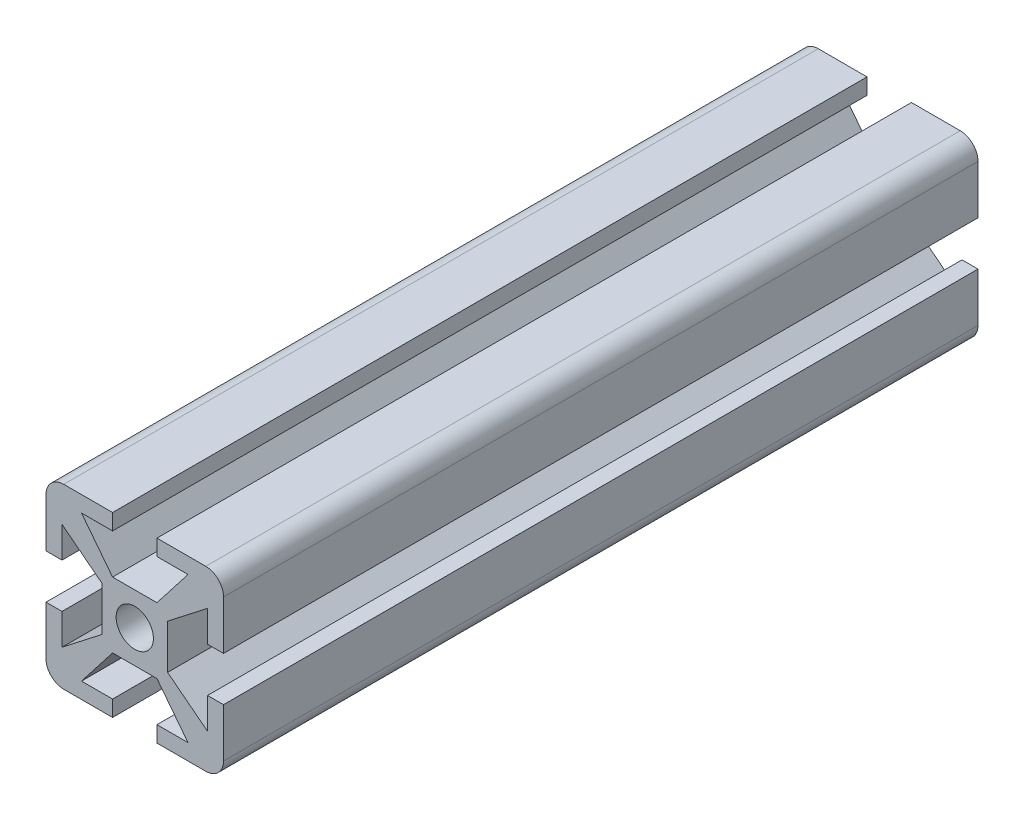
from build123d import *

# Parameters (mm, degrees)
EXTRUSION1_DEPTH        = 85
PER_AGE1_OUTLINE_R      = 2.1
PER_AGE1_DEPTH          = 85
ENL_V_MAT_EXTRU_1_DEPTH = 300
ENL_V_MAT_EXTRU_3_DEPTH = 300
ENL_V_MAT_EXTRU_4_DEPTH = 87.168439698
ENL_V_MAT_EXTRU_7_DEPTH = 87.168439698


# Read off the part's stored shape, not the designer's step: Perçage1
with BuildPart() as part:
    # Esquisse1 → Extrusion1 (new body)
    with BuildSketch(Plane.XY):
        with BuildLine():
            Line((-10, 8), (-10, -8))
            ThreePointArc((-10, -8), (-9.414213562, -9.414213562), (-8, -10))
            Line((-8, -10), (8, -10))
            ThreePointArc((8, -10), (9.414213562, -9.414213562), (10, -8))
            Line((10, -8), (10, 8))
            ThreePointArc((10, 8), (9.414213562, 9.414213562), (8, 10))
            Line((8, 10), (-8, 10))
            ThreePointArc((-8, 10), (-9.414213562, 9.414213562), (-10, 8))
        make_face()
    extrude(amount=EXTRUSION1_DEPTH)

    # Perçage1 outline → Perçage1 (cut)
    with BuildSketch(Plane.XY):
        Circle(PER_AGE1_OUTLINE_R)
    extrude(amount=PER_AGE1_DEPTH, mode=Mode.SUBTRACT)

    # Esquisse3 → Enlèv. mat.-Extru.1 (cut)
    with BuildSketch(Plane.XY.offset(85)):
        Polygon((10, 2.5), (8.2, 2.5), (8.2, 6), (3.7, 2.5), (3.7, -2.5), (8.2, -6), (8.2, -2.5), (10, -2.5), align=None)
    extrude(amount=-ENL_V_MAT_EXTRU_1_DEPTH, mode=Mode.SUBTRACT)

    # Esquisse5 → Enlèv. mat.-Extru.3 (cut)
    with BuildSketch(Plane.XY.offset(85)):
        Polygon((-2.5, 10), (-2.5, 8.2), (-6, 8.2), (-2.5, 3.7), (2.5, 3.7), (6, 8.2), (2.5, 8.2), (2.5, 10), align=None)
    extrude(amount=-ENL_V_MAT_EXTRU_3_DEPTH, mode=Mode.SUBTRACT)

    # Esquisse6 → Enlèv. mat.-Extru.4 (cut, through all)
    with BuildSketch(Plane.XY.offset(85)):
        Polygon((-2.5, -10), (-2.5, -8.2), (-6, -8.2), (-2.5, -3.7), (2.5, -3.7), (6, -8.2), (2.5, -8.2), (2.5, -10), align=None)
    extrude(amount=-ENL_V_MAT_EXTRU_4_DEPTH, mode=Mode.SUBTRACT)

    # Esquisse4 → Enlèv. mat.-Extru.7 (cut, through all)
    with BuildSketch(Plane.XY.offset(85)):
        Polygon((-10, 2.5), (-8.2, 2.5), (-8.2, 6), (-3.7, 2.5), (-3.7, -2.5), (-8.2, -6), (-8.2, -2.5), (-10, -2.5), align=None)
    extrude(amount=-ENL_V_MAT_EXTRU_7_DEPTH, mode=Mode.SUBTRACT)


solid = part.part
